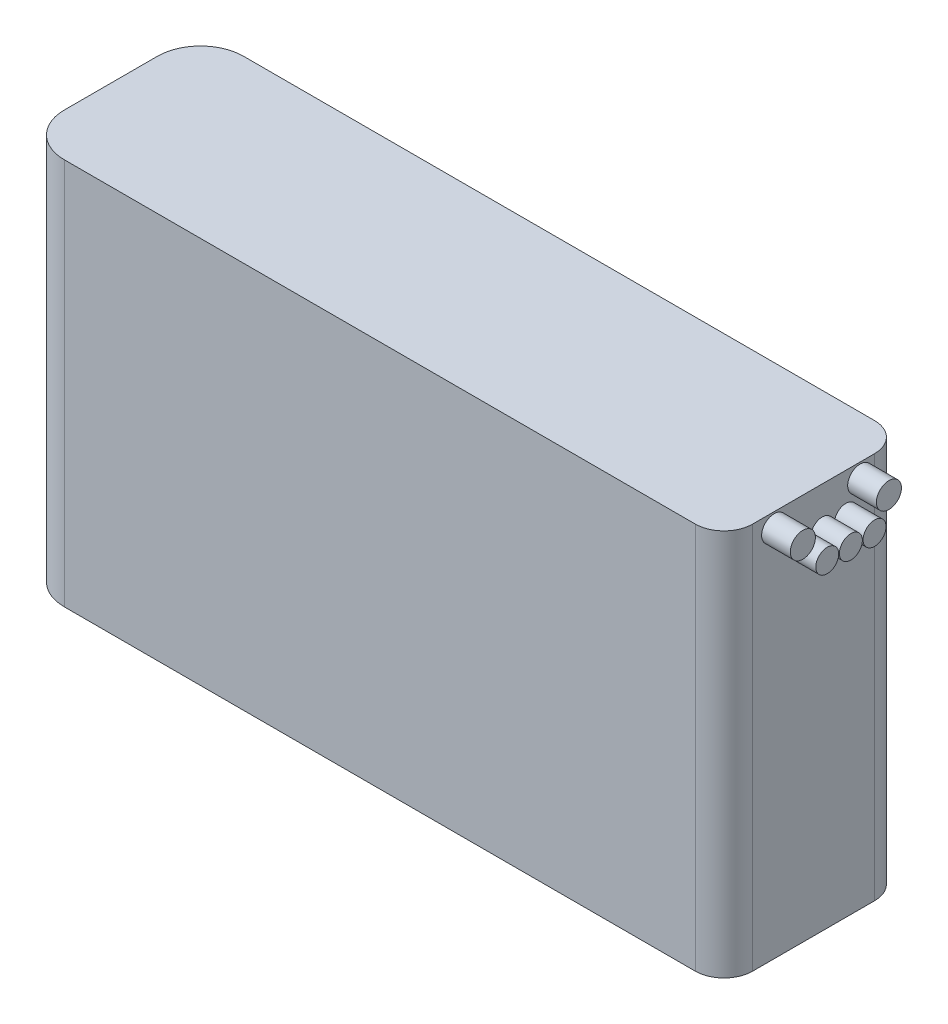
from build123d import *

# Parameters (mm, degrees)
SKIZZE1_W                       = 49
SKIZZE1_H                       = 27
AUFSATZ_LINEAR_AUSTRAGEN1_DEPTH = 12.5
VERRUNDUNG1_R                   = 2
VERRUNDUNG2_R                   = 3
SKIZZE3_R                       = 0.875
SKIZZE3_R_2                     = 0.8
AUFSATZ_LINEAR_AUSTRAGEN2_DEPTH = 2


with BuildPart() as part:
    # Skizze1 → Aufsatz-Linear austragen1 (new body)
    with BuildSketch(Plane.XY):
        with Locations((24.5, 13.5)):
            Rectangle(SKIZZE1_W, SKIZZE1_H)
    extrude(amount=AUFSATZ_LINEAR_AUSTRAGEN1_DEPTH)

    # Verrundung1
    verrundung1_edges = [part.edges().sort_by_distance(p)[0] for p in [
        (49, 13.5, 0),
        (49, 13.5, 12.5),
    ]]
    fillet(verrundung1_edges, radius=VERRUNDUNG1_R)

    # Verrundung2
    verrundung2_edges = [part.edges().sort_by_distance(p)[0] for p in [
        (0, 13.5, 12.5),
        (0, 13.5, 0),
    ]]
    fillet(verrundung2_edges, radius=VERRUNDUNG2_R)

    # Skizze3 → Aufsatz-Linear austragen2 (add)
    with BuildSketch(Plane(origin=(49, 0, 0), x_dir=(0, 0, -1), z_dir=(1, 0, 0))):
        with Locations((-9, 26)):
            Circle(SKIZZE3_R)
        with Locations((-3, 26)):
            Circle(SKIZZE3_R)
        with Locations((-4, 24.2)):
            Circle(SKIZZE3_R_2)
        with Locations((-5.65, 24.2)):
            Circle(SKIZZE3_R_2)
        with Locations((-7.3, 24.2)):
            Circle(SKIZZE3_R_2)
    extrude(amount=AUFSATZ_LINEAR_AUSTRAGEN2_DEPTH)


solid = part.part
